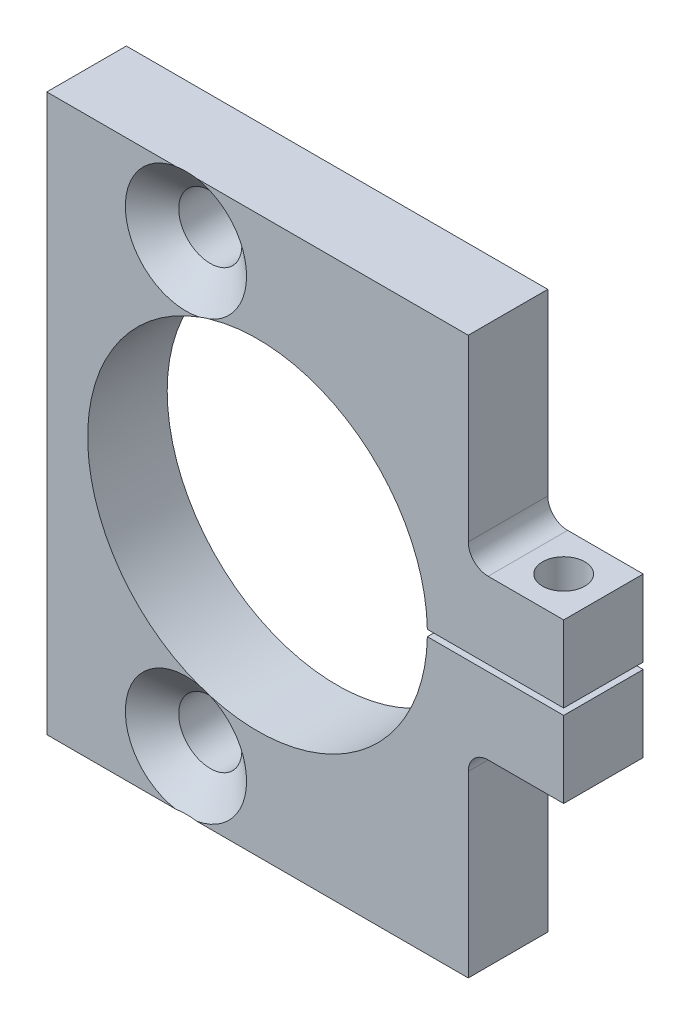
from build123d import *

# Parameters (mm, degrees)
SKETCH1_W                                           = 82.55
SKETCH1_H                                           = 88.9
EXTRUDE1_DEPTH                                      = 12.7
SKETCH2_R                                           = 27.1272
EXTRUDE2_DEPTH                                      = 62.973527615
SKETCH3_W                                           = 28.468633454
SKETCH3_H                                           = 1.016
EXTRUDE3_DEPTH                                      = 62.973527615
F_1_4_CLEARANCE_HOLE1_D                             = 6.7564
CSK_FOR_3_8_FLAT_HEAD_MACHINE_SCREW_100_D           = 10.0838
CSK_FOR_3_8_FLAT_HEAD_MACHINE_SCREW_100_CSINK_D     = 19.3548
CSK_FOR_3_8_FLAT_HEAD_MACHINE_SCREW_100_CSINK_ANGLE = 100
SKETCH10_W                                          = 15.24
SKETCH10_H                                          = 31.75
EXTRUDE4_DEPTH                                      = 62.973527707
FILLET1_R                                           = 3.175


with BuildPart() as part:
    # Sketch1 → Extrude1 (new body)
    with BuildSketch(Plane.XY):
        Rectangle(SKETCH1_W, SKETCH1_H)
    extrude(amount=EXTRUDE1_DEPTH)

    # Sketch2 → Extrude2 (cut, through all)
    with BuildSketch(Plane.XY.offset(12.7)):
        with Locations((-7.62, 0)):
            Circle(SKETCH2_R)
    extrude(amount=-EXTRUDE2_DEPTH, mode=Mode.SUBTRACT)

    # Sketch3 → Extrude3 (cut, through all)
    with BuildSketch(Plane.XY.offset(12.7)):
        with Locations((30.3911, 0)):
            Rectangle(SKETCH3_W, SKETCH3_H)
    extrude(amount=-EXTRUDE3_DEPTH, mode=Mode.SUBTRACT)

    # 1/4 Clearance Hole1 (through all)
    with Locations(Plane(origin=(34.925, 44.45, 6.35), x_dir=(0, 0, 1), z_dir=(0, 1, 0))):
        with Locations((0, 0)):
            Hole(F_1_4_CLEARANCE_HOLE1_D / 2)

    # CSK for 3/8 Flat Head Machine Screw (100)1 (through all)
    with Locations(Plane(origin=(-19.05, 34.925, 12.7), x_dir=(1, 0, 0), z_dir=(0, 0, 1))):
        with Locations((0, 0)):
            csk_for_3_8_flat_head_machine_screw_100 = CounterSinkHole(CSK_FOR_3_8_FLAT_HEAD_MACHINE_SCREW_100_D / 2, CSK_FOR_3_8_FLAT_HEAD_MACHINE_SCREW_100_CSINK_D / 2, counter_sink_angle=CSK_FOR_3_8_FLAT_HEAD_MACHINE_SCREW_100_CSINK_ANGLE)

    # Mirror1: CSK for 3/8 Flat Head Machine Screw (100)1 across plane
    add(csk_for_3_8_flat_head_machine_screw_100.mirror(Plane.ZX), mode=Mode.SUBTRACT)

    # Sketch10 → Extrude4 (cut, through all)
    with BuildSketch(Plane.XY.offset(12.7)):
        with Locations((33.655, 28.575)):
            Rectangle(SKETCH10_W, SKETCH10_H)
    extrude4 = extrude(amount=-EXTRUDE4_DEPTH, mode=Mode.SUBTRACT)

    # Mirror2: Extrude4 across plane
    add(extrude4.mirror(Plane.ZX), mode=Mode.SUBTRACT)

    # Fillet1
    fillet1_edges = [part.edges().sort_by_distance(p)[0] for p in [
        (26.035, -12.7, 6.35),
        (26.035, 12.7, 6.35),
    ]]
    fillet(fillet1_edges, radius=FILLET1_R)


solid = part.part
